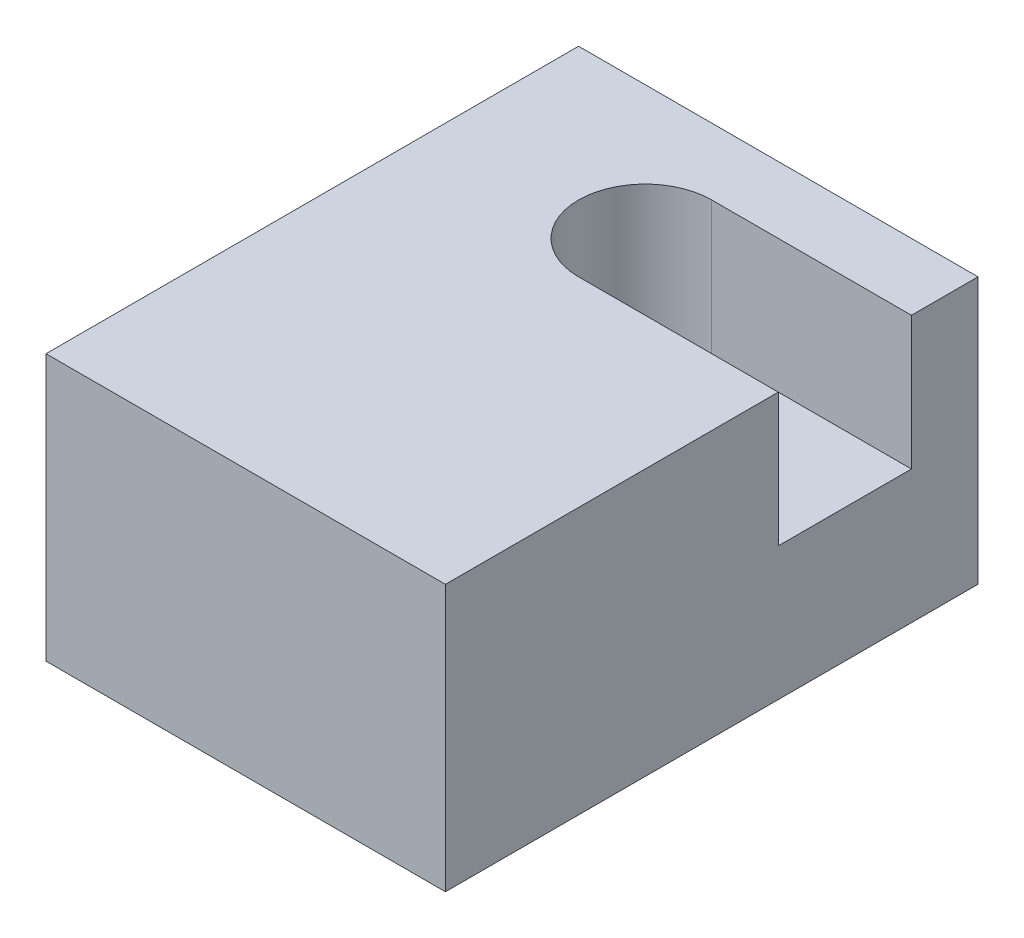
from build123d import *

# Parameters (mm, degrees)
SKETCH1_W           = 38.1
SKETCH1_H           = 25.4
BOSS_EXTRUDE1_DEPTH = 50.8
CUT_EXTRUDE1_DEPTH  = 12.7


with BuildPart() as part:
    # Sketch1 → Boss-Extrude1 (new body)
    with BuildSketch(Plane.XY):
        Rectangle(SKETCH1_W, SKETCH1_H)
    extrude(amount=BOSS_EXTRUDE1_DEPTH)

    # Sketch2 → Cut-Extrude1 (cut)
    with BuildSketch(Plane(origin=(0, 12.7, 0), x_dir=(1, 0, 0), z_dir=(0, 1, 0))):
        with BuildLine():
            Line((19.05, -6.35), (0, -6.35))
            ThreePointArc((0, -6.35), (-6.35, -12.7), (0, -19.05))
            Line((0, -19.05), (19.05, -19.05))
            Line((19.05, -19.05), (19.05, -6.35))
        make_face()
    extrude(amount=-CUT_EXTRUDE1_DEPTH, mode=Mode.SUBTRACT)


solid = part.part
